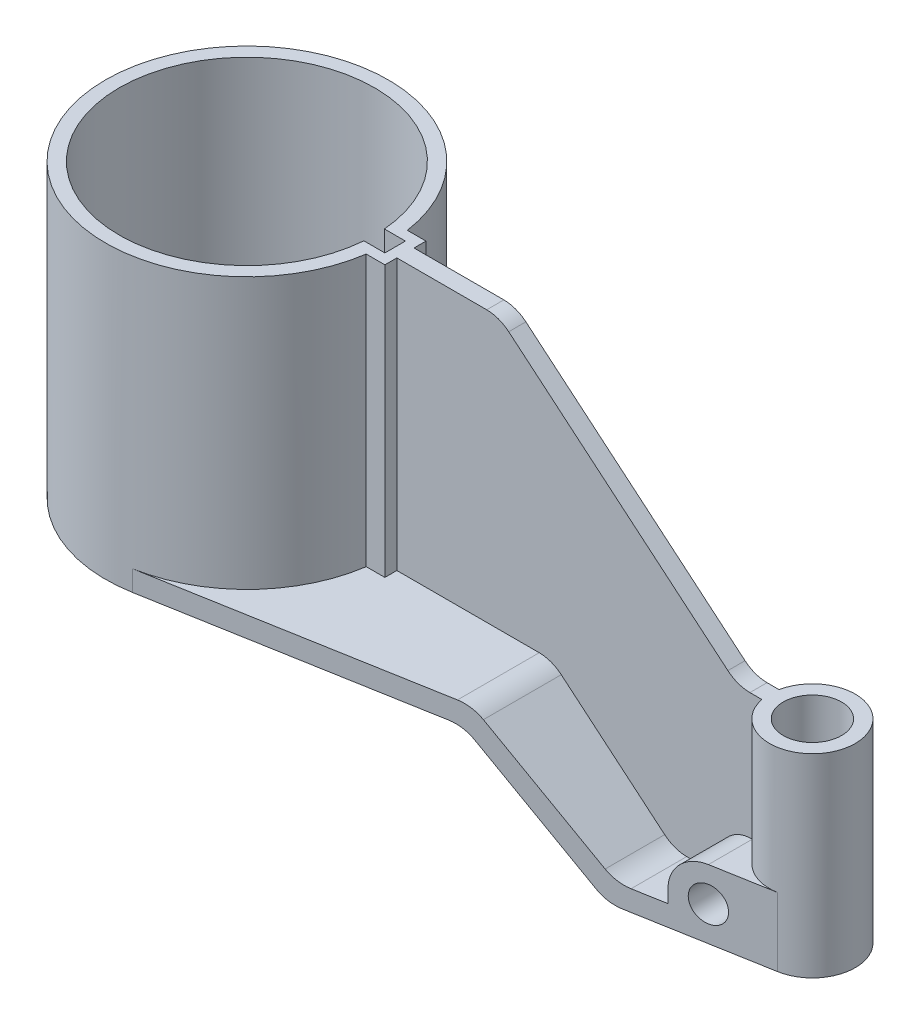
from build123d import *

# Parameters (mm, degrees)
BOSS_EXTRUDE1_DEPTH     = 85
BOSS_EXTRUDE2_START     = -30
SKETCH2_3_R             = 12.5
BOSS_EXTRUDE2_DEPTH     = 56.666666667
EXTRUDE_THIN1_DEPTH     = 115
SKETCH5_W               = 50
SKETCH5_H               = 20
BOSS_EXTRUDE3_DEPTH     = 230
CUT_EXTRUDE2_DEPTH      = 311.201547385
CUT_EXTRUDE2_DEPTH_BACK = 311.201547385
SKETCH5_3_R             = 5
CUT_EXTRUDE1_START      = -30
CUT_EXTRUDE1_OUTLINE_R  = 8.5
CUT_EXTRUDE1_DEPTH      = 115
RIB1_START              = -2.5
RIB1_DEPTH              = 5
FILLET1_R               = 10


# Read off the part's stored shape, not the designer's step: Cut-Extrude1, Rib1
with BuildPart() as part:
    # Sketch2 → Boss-Extrude1 (new body)
    with BuildSketch(Plane(origin=(0, 0, 0), x_dir=(1, 0, 0), z_dir=(0, 1, 0))):
        with BuildLine():
            Line((40.811303581, 6), (46.25, 6))
            Line((46.25, 6), (46.25, -6))
            Line((46.25, -6), (40.811303581, -6))
            ThreePointArc((40.811303581, -6), (-41.25, 0), (40.811303581, 6))
        make_face()
    extrude(amount=BOSS_EXTRUDE1_DEPTH)



with BuildPart() as body_2:
    # Sketch2<3> → Boss-Extrude2 (new body)
    with BuildSketch(Plane(origin=(0, 0, 0), x_dir=(1, 0, 0), z_dir=(0, 1, 0)).offset(BOSS_EXTRUDE2_START)):
        with Locations(Location((165, 0, 0), (0, 0, 270))):
            Circle(SKETCH2_3_R)
    extrude(amount=BOSS_EXTRUDE2_DEPTH)


with BuildPart() as part_1:
    add(part.part)

    add(body_2.part)  # Extrude-Thin1 merges body 2
    # Sketch3 → Extrude-Thin1 (add, symmetric)
    with BuildSketch(Plane.XY):
        Polygon((-41.25, 0), (89.247392222, 0), (125, -30), (177.5, -30), (177.5, -24), (127.183821406, -24), (91.431213628, 6), (-41.25, 6), align=None)
    extrude(amount=EXTRUDE_THIN1_DEPTH, both=True)

    # Sketch5 → Boss-Extrude3 (add)
    with BuildSketch(Plane.XY.offset(115)):
        with Locations((165, -20)):
            Rectangle(SKETCH5_W, SKETCH5_H)
    extrude(amount=-BOSS_EXTRUDE3_DEPTH)

    # Sketch5<3> → Cut-Extrude2 (cut, two sides: drawn at the far end of the back side and taken through both)
    with BuildSketch(Plane.XY.offset(115).offset(-CUT_EXTRUDE2_DEPTH_BACK)):
        with Locations((150, -20)):
            Circle(SKETCH5_3_R)
    extrude(amount=CUT_EXTRUDE2_DEPTH + CUT_EXTRUDE2_DEPTH_BACK, mode=Mode.SUBTRACT)

    # Cut-Extrude1 outline → Cut-Extrude1 (cut)
    with BuildSketch(Plane(origin=(0, 0, 0), x_dir=(1, 0, 0), z_dir=(0, 1, 0)).offset(CUT_EXTRUDE1_START)):
        with BuildLine():
            ThreePointArc((167.178030303, 12.30878483), (174.5779794, 8.03195559), (177.5, 0))
            ThreePointArc((177.5, 0), (174.5779794, -8.03195559), (167.178030303, -12.30878483))
            Line((167.178030303, -12.30878483), (140, -17.117917039))
            Line((140, -17.117917039), (140, -115))
            Line((140, -115), (190, -115))
            Line((190, -115), (190, 115))
            Line((190, 115), (140, 115))
            Line((140, 115), (140, 17.117917039))
            Line((140, 17.117917039), (167.178030303, 12.30878483))
        make_face()
        with BuildLine():
            Line((7.1875, 40.61898994), (140, 17.117917039))
            Line((140, 17.117917039), (140, 115))
            Line((140, 115), (-41.25, 115))
            Line((-41.25, 115), (-41.25, -8.8e-08))
            ThreePointArc((-41.25, -8.8e-08), (-26.505453482, 31.607331993), (7.1875, 40.61898994))
        make_face()
        with BuildLine():
            Line((140, -115), (140, -17.117917039))
            Line((140, -17.117917039), (7.1875, -40.61898994))
            ThreePointArc((7.1875, -40.61898994), (-26.505453415, -31.607332049), (-41.25, -8.8e-08))
            Line((-41.25, -8.8e-08), (-41.25, -115))
            Line((-41.25, -115), (140, -115))
        make_face()
        with Locations((165, 0)):
            Circle(CUT_EXTRUDE1_OUTLINE_R)
        with BuildLine():
            Line((43.25, 3), (37.128998101, 3))
            ThreePointArc((37.128998101, 3), (-37.25, 0), (37.128998101, -3))
            Line((37.128998101, -3), (43.25, -3))
            Line((43.25, -3), (43.25, 3))
        make_face()
    extrude(amount=CUT_EXTRUDE1_DEPTH, mode=Mode.SUBTRACT)

    # Rib1 outline → Rib1 (add)
    with BuildSketch(Plane.XY.offset(RIB1_START)):
        Polygon((145.624979942, 26.666666667), (76.106020374, 85), (46.25, 85), (46.25, 6), (91.431213628, 6), (127.183821406, -24), (140, -24), (140, -10), (154, -10), (154, 26.666666667), align=None)
    extrude(amount=RIB1_DEPTH)

    # Fillet1
    fillet1_edges = [part_1.edges().sort_by_distance(p)[0] for p in [
        (140, -10, 9.80895852),
        (127.183821406, -24, -10.942865145),
        (91.431213628, 6, -14.106063797),
        (145.624979942, 26.666666667, 0),
        (76.106020374, 85, 0),
        (140, -10, -9.808958519),
        (89.247392222, 0, 0),
        (91.431213628, 6, 14.106063797),
        (127.183821406, -24, 10.942865145),
        (125, -30, 0),
    ]]
    fillet(fillet1_edges, radius=FILLET1_R)


solid = part_1.part
